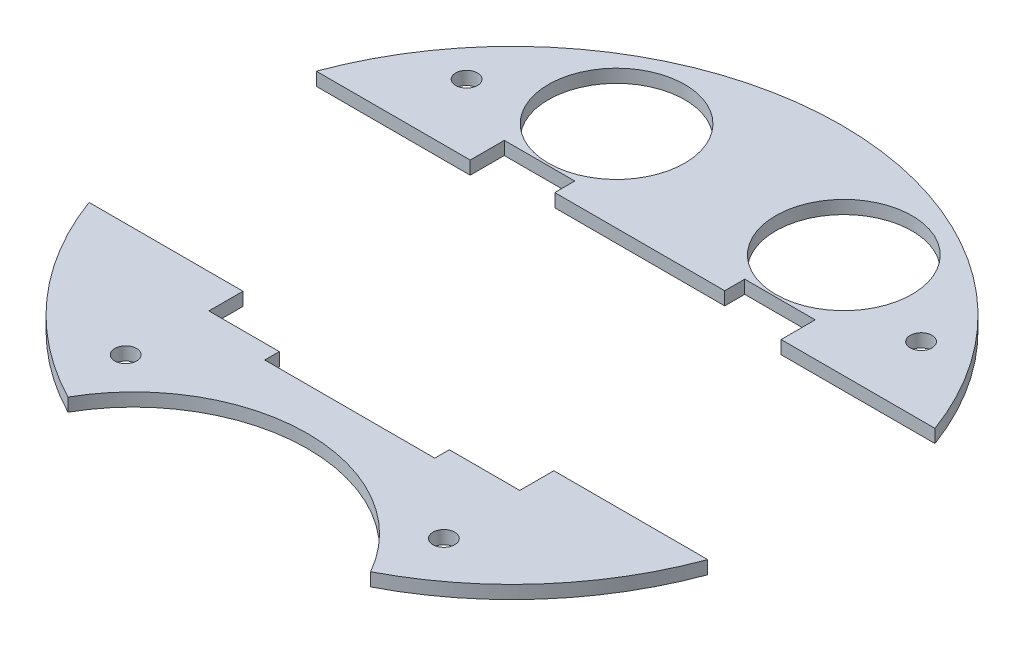
from build123d import *

# Parameters (mm, degrees)
BOSS_EXTRUDE1_DEPTH  = 2.9
SOLENOID_PLACEMENT_W = 37.4
SOLENOID_PLACEMENT_H = 63.8
CUT_EXTRUDE1_DEPTH   = 103.571487266
SKETCH7_R            = 15
CUT_EXTRUDE6_DEPTH   = 103.571487266
SKETCH8_R            = 2.4
CUT_EXTRUDE7_DEPTH   = 103.571487266
CUT_EXTRUDE3_DEPTH   = 103.571487266


with BuildPart() as part:
    # Sketch1 → Boss-Extrude1 (new body)
    with BuildSketch(Plane(origin=(0, 0, 0), x_dir=(1, 0, 0), z_dir=(0, 1, 0))):
        with BuildLine():
            ThreePointArc((33.29110537, -64.404598464), (0, 72.5), (-33.29110537, -64.404598464))
            ThreePointArc((-33.29110537, -64.404598464), (0, -44.989799638), (33.29110537, -64.404598464))
        make_face()
    extrude(amount=BOSS_EXTRUDE1_DEPTH)

    # solenoid placement → Cut-Extrude1 (cut, through all)
    with BuildSketch(Plane(origin=(0, 2.9, 0), x_dir=(1, 0, 0), z_dir=(0, 1, 0))):
        with Locations((0, -3.8)):
            Rectangle(SOLENOID_PLACEMENT_W, SOLENOID_PLACEMENT_H)
    extrude(amount=-CUT_EXTRUDE1_DEPTH, mode=Mode.SUBTRACT)

    # Sketch7 → Cut-Extrude6 (cut, through all)
    with BuildSketch(Plane(origin=(0, 2.9, 0), x_dir=(1, 0, 0), z_dir=(0, 1, 0))):
        with Locations((25, 48)):
            Circle(SKETCH7_R)
        with Locations((-25, 48)):
            Circle(SKETCH7_R)
    extrude(amount=-CUT_EXTRUDE6_DEPTH, mode=Mode.SUBTRACT)

    # Sketch8 → Cut-Extrude7 (cut, through all)
    with BuildSketch(Plane(origin=(0, 2.9, 0), x_dir=(1, 0, 0), z_dir=(0, 1, 0))):
        with Locations((35, -50)):
            Circle(SKETCH8_R)
        with Locations((-35, -50)):
            Circle(SKETCH8_R)
        with Locations((-50, 40)):
            Circle(SKETCH8_R)
        with Locations((50, 40)):
            Circle(SKETCH8_R)
    extrude(amount=-CUT_EXTRUDE7_DEPTH, mode=Mode.SUBTRACT)

    # Sketch3 → Cut-Extrude3 (cut, through all)
    with BuildSketch(Plane(origin=(0, 2.9, 0), x_dir=(1, 0, 0), z_dir=(0, 1, 0))):
        with BuildLine():
            Line((-34.2, -32.5), (-22.2, -32.5))
            Line((-22.2, -32.5), (-18.7, -32.5))
            Line((-18.7, -32.5), (-18.7, 32.5))
            Line((-18.7, 32.5), (-22.2, 32.5))
            Line((-22.2, 32.5), (-34.2, 32.5))
            Line((-34.2, 32.5), (-34.2, 25))
            Line((-34.2, 25), (-68.053287944, 25))
            ThreePointArc((-68.053287944, 25), (-72.5, 0), (-68.053287944, -25))
            Line((-68.053287944, -25), (-34.2, -25))
            Line((-34.2, -25), (-34.2, -32.5))
        make_face()
        with BuildLine():
            Line((18.7, 32.5), (18.7, -32.5))
            Line((18.7, -32.5), (22.2, -32.5))
            Line((22.2, -32.5), (34.2, -32.5))
            Line((34.2, -32.5), (34.2, -25))
            Line((34.2, -25), (68.053287944, -25))
            ThreePointArc((68.053287944, -25), (72.5, 0), (68.053287944, 25))
            Line((68.053287944, 25), (34.2, 25))
            Line((34.2, 25), (34.2, 32.5))
            Line((34.2, 32.5), (22.2, 32.5))
            Line((22.2, 32.5), (18.7, 32.5))
        make_face()
    extrude(amount=-CUT_EXTRUDE3_DEPTH, mode=Mode.SUBTRACT)


with BuildPart() as cut_extrude3_piece_1:
    # of the separate pieces the step leaves, piece 1, a body of its own (cut_extrude3_pieces)
    add(part.part.solids().sort_by_distance((68.053287944, 0, -25))[0])


with BuildPart() as cut_extrude3_piece_2:
    # of the separate pieces the step leaves, piece 2, a body of its own (cut_extrude3_pieces)
    add(part.part.solids().sort_by_distance((-33.29110537, 0, 64.404598464))[0])


solid = Compound([cut_extrude3_piece_1.part, cut_extrude3_piece_2.part])
